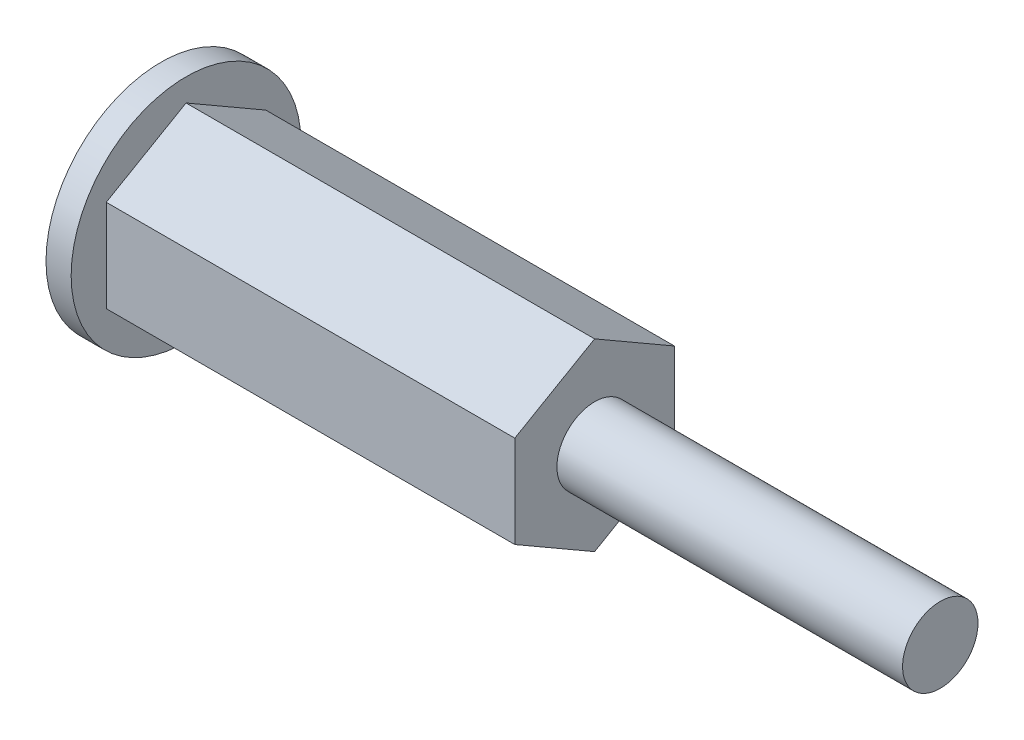
from build123d import *

# Parameters (mm, degrees)
SKETCH1_R           = 2.999
BOSS_EXTRUDE1_DEPTH = 60
SKETCH2_R           = 9.141
BOSS_EXTRUDE2_DEPTH = 2
BOSS_EXTRUDE3_DEPTH = 32.5


with BuildPart() as part:
    # Sketch1 → Boss-Extrude1 (new body)
    with BuildSketch(Plane.YZ):
        Circle(SKETCH1_R)
    extrude(amount=BOSS_EXTRUDE1_DEPTH)

    # Sketch2 → Boss-Extrude2 (add)
    with BuildSketch(Plane(origin=(0, 0, 0), x_dir=(0, -1, 0), z_dir=(-1, 0, 0))):
        Circle(SKETCH2_R)
    extrude(amount=BOSS_EXTRUDE2_DEPTH)

    # Sketch3 → Boss-Extrude3 (add)
    with BuildSketch(Plane.YZ):
        Polygon((3.665, 6.34796621), (-3.665, 6.34796621), (-7.33, 0), (-3.665, -6.34796621), (3.665, -6.34796621), (7.33, 0), align=None)
    extrude(amount=BOSS_EXTRUDE3_DEPTH)


solid = part.part
